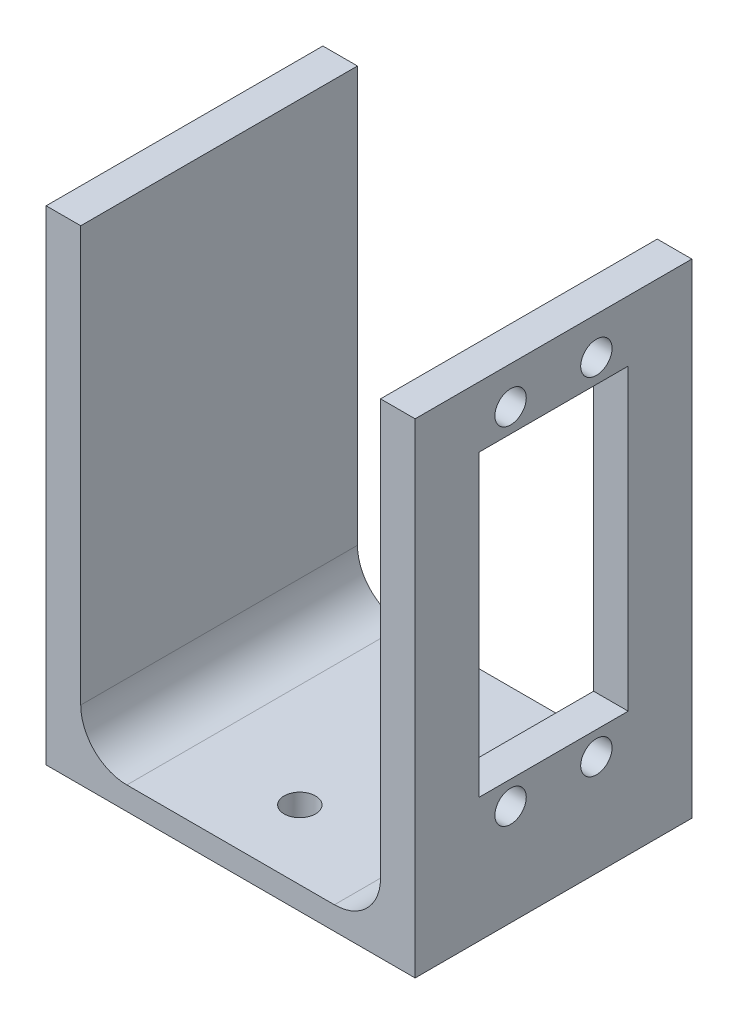
from build123d import *

# Parameters (mm, degrees)
SKETCH1_W           = 50.8
SKETCH1_H           = 38.1
BOSS_EXTRUDE1_DEPTH = 3.175
SKETCH2_W           = 4.7625
SKETCH2_H           = 38.1
BOSS_EXTRUDE2_DEPTH = 63.5
FILLET1_R           = 6.35
CUT_EXTRUDE1_REACH  = 94.075
SKETCH3_R           = 2.159
SKETCH3_W           = 20.574
SKETCH3_H           = 41.148
CUT_EXTRUDE2_REACH  = 91.803
SKETCH4_R           = 2.159


with BuildPart() as part:
    # Sketch1 → Boss-Extrude1 (new body)
    with BuildSketch(Plane(origin=(0, 0, 0), x_dir=(1, 0, 0), z_dir=(0, 1, 0))):
        with Locations((25.4, 19.05)):
            Rectangle(SKETCH1_W, SKETCH1_H)
    extrude(amount=BOSS_EXTRUDE1_DEPTH)

    # Sketch2 → Boss-Extrude2 (add)
    with BuildSketch(Plane(origin=(0, 3.175, 0), x_dir=(1, 0, 0), z_dir=(0, 1, 0))):
        with Locations((48.41875, 19.05)):
            Rectangle(SKETCH2_W, SKETCH2_H)
        with Locations((2.38125, 19.05)):
            Rectangle(SKETCH2_W, SKETCH2_H)
    extrude(amount=BOSS_EXTRUDE2_DEPTH)

    # Fillet1
    fillet1_edges = [part.edges().sort_by_distance(p)[0] for p in [
        (4.7625, 3.175, -19.05),
        (46.0375, 3.175, -19.05),
    ]]
    fillet(fillet1_edges, radius=FILLET1_R)

    # Sketch3 → Cut-Extrude1 (cut, up to next)
    with BuildSketch(Plane(origin=(50.8, 0, 0), x_dir=(0, 0, -1), z_dir=(1, 0, 0)), mode=Mode.PRIVATE) as cut_extrude1_sk1:
        with Locations((24.9555, 61.5315)):
            Circle(SKETCH3_R)
    cut_extrude1_tool1 = extrude(cut_extrude1_sk1.sketch, amount=-CUT_EXTRUDE1_REACH, mode=Mode.PRIVATE) & part.part
    # Sketch3 → Cut-Extrude1 (cut, up to next)
    with BuildSketch(Plane(origin=(50.8, 0, 0), x_dir=(0, 0, -1), z_dir=(1, 0, 0)), mode=Mode.PRIVATE) as cut_extrude1_sk2:
        with Locations((13.1445, 61.5315)):
            Circle(SKETCH3_R)
    cut_extrude1_tool2 = extrude(cut_extrude1_sk2.sketch, amount=-CUT_EXTRUDE1_REACH, mode=Mode.PRIVATE) & part.part
    # Sketch3 → Cut-Extrude1 (cut, up to next)
    with BuildSketch(Plane(origin=(50.8, 0, 0), x_dir=(0, 0, -1), z_dir=(1, 0, 0)), mode=Mode.PRIVATE) as cut_extrude1_sk3:
        with Locations((13.1445, 13.9065)):
            Circle(SKETCH3_R)
    cut_extrude1_tool3 = extrude(cut_extrude1_sk3.sketch, amount=-CUT_EXTRUDE1_REACH, mode=Mode.PRIVATE) & part.part
    # Sketch3 → Cut-Extrude1 (cut, up to next)
    with BuildSketch(Plane(origin=(50.8, 0, 0), x_dir=(0, 0, -1), z_dir=(1, 0, 0)), mode=Mode.PRIVATE) as cut_extrude1_sk4:
        with Locations((24.9555, 13.9065)):
            Circle(SKETCH3_R)
    cut_extrude1_tool4 = extrude(cut_extrude1_sk4.sketch, amount=-CUT_EXTRUDE1_REACH, mode=Mode.PRIVATE) & part.part
    # Sketch3 → Cut-Extrude1 (cut, up to next)
    with BuildSketch(Plane(origin=(50.8, 0, 0), x_dir=(0, 0, -1), z_dir=(1, 0, 0)), mode=Mode.PRIVATE) as cut_extrude1_sk5:
        with Locations((19.05, 37.719)):
            Rectangle(SKETCH3_W, SKETCH3_H)
    cut_extrude1_tool5 = extrude(cut_extrude1_sk5.sketch, amount=-CUT_EXTRUDE1_REACH, mode=Mode.PRIVATE) & part.part
    add(cut_extrude1_tool1.solids().sort_by_distance((50.8, 61.5315, -24.9555))[0], mode=Mode.SUBTRACT)
    add(cut_extrude1_tool2.solids().sort_by_distance((50.8, 61.5315, -13.1445))[0], mode=Mode.SUBTRACT)
    add(cut_extrude1_tool3.solids().sort_by_distance((50.8, 13.9065, -13.1445))[0], mode=Mode.SUBTRACT)
    add(cut_extrude1_tool4.solids().sort_by_distance((50.8, 13.9065, -24.9555))[0], mode=Mode.SUBTRACT)
    add(cut_extrude1_tool5.solids().sort_by_distance((50.8, 37.719, -19.05))[0], mode=Mode.SUBTRACT)

    # Sketch4 → Cut-Extrude2 (cut, up to next)
    with BuildSketch(Plane(origin=(0, 3.175, 0), x_dir=(1, 0, 0), z_dir=(0, 1, 0)), mode=Mode.PRIVATE) as cut_extrude2_sk1:
        with Locations((25.4, 28.575)):
            Circle(SKETCH4_R)
    cut_extrude2_tool1 = extrude(cut_extrude2_sk1.sketch, amount=-CUT_EXTRUDE2_REACH, mode=Mode.PRIVATE) & part.part
    # Sketch4 → Cut-Extrude2 (cut, up to next)
    with BuildSketch(Plane(origin=(0, 3.175, 0), x_dir=(1, 0, 0), z_dir=(0, 1, 0)), mode=Mode.PRIVATE) as cut_extrude2_sk2:
        with Locations((25.4, 9.525)):
            Circle(SKETCH4_R)
    cut_extrude2_tool2 = extrude(cut_extrude2_sk2.sketch, amount=-CUT_EXTRUDE2_REACH, mode=Mode.PRIVATE) & part.part
    add(cut_extrude2_tool1.solids().sort_by_distance((25.4, 3.175, -28.575))[0], mode=Mode.SUBTRACT)
    add(cut_extrude2_tool2.solids().sort_by_distance((25.4, 3.175, -9.525))[0], mode=Mode.SUBTRACT)


solid = part.part
